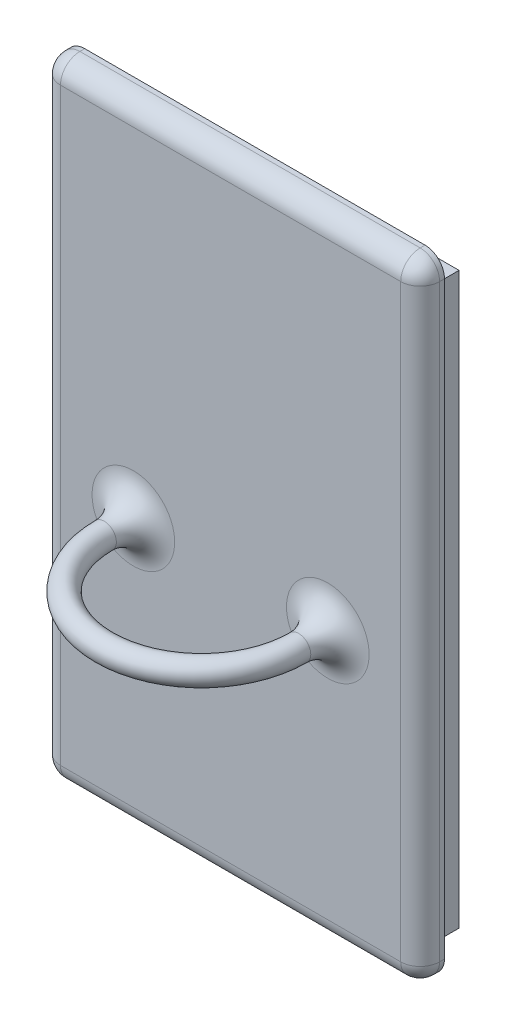
from build123d import *

# Parameters (mm, degrees)
BOSS_EXTRUDE1_DEPTH = 3.175
SWEEP1_PROFILE_R    = 1.5875
FILLET1_R           = 3.81
SKETCH14_W          = 49.53
SKETCH14_H          = 3.81
BOSS_EXTRUDE4_DEPTH = 3.175
FILLET2_R           = 2.54
FILLET4_R           = 2.54
SKETCH15_W          = 46.99
SKETCH15_H          = 74.422
SKETCH15_W_2        = 40.64
SKETCH15_H_2        = 68.072
BOSS_EXTRUDE6_DEPTH = 3.175


# Some blends are built 0.0001 mm under size
with BuildPart() as part:
    # Sketch1 → Boss-Extrude1 (new body)
    with BuildSketch(Plane.XY):
        Polygon((-24.765, -37.211), (24.765, -37.211), (24.765, -18.570359608), (24.765, 0.678999912), (24.765, 37.211), (-24.765, 37.211), (-24.765, 0.678999912), (-24.765, -18.570359608), align=None)
    extrude(amount=BOSS_EXTRUDE1_DEPTH)

    # Sweep1: sweep along a path in Sketch7
    with BuildLine(Plane(origin=(0, -5.770679848, 0), x_dir=(1, 0, 0), z_dir=(0, 1, 0))) as sweep1_path:
        Line((-12.7, -3.175), (-12.7, -6.985))
        ThreePointArc((-12.7, -6.985), (0, -19.685), (12.7, -6.985))
        Line((12.7, -6.985), (12.7, -3.175))
    # Sweep1 profile (on start of the path) → Sweep1 (sweep)
    with BuildSketch(Plane(origin=(-12.7, -5.770679848, 3.175), x_dir=(1, 0, 0), z_dir=(0, 0, 1))):
        Circle(SWEEP1_PROFILE_R)
    sweep(path=sweep1_path.line)

    # Fillet1
    fillet1_edges = [part.edges().sort_by_distance(p)[0] for p in [
        (14.2875, -5.770679848, 3.175),
        (-14.2875, -5.770679848, 3.175),
    ]]
    fillet(fillet1_edges, radius=FILLET1_R - 0.0001)  # a hair under: the kernel refuses the full size

    # Sketch14 → Boss-Extrude4 (add)
    with BuildSketch(Plane.XY.offset(3.175)):
        with Locations((0, -39.116)):
            Rectangle(SKETCH14_W, SKETCH14_H)
        with Locations((0, 39.116)):
            Rectangle(SKETCH14_W, SKETCH14_H)
    extrude(amount=-BOSS_EXTRUDE4_DEPTH)

    # Fillet2
    fillet2_edges = [part.edges().sort_by_distance(p)[0] for p in [
        (-24.765, 0, 3.175),
        (0, -41.021, 3.175),
        (24.765, 0, 3.175),
        (0, 41.021, 3.175),
    ]]
    fillet(fillet2_edges, radius=FILLET2_R)

    # Fillet4
    # the kernel refuses this fillet: 2.54 mm, written as the material it takes off along each edge
    with BuildSketch(Plane(origin=(-22.225, -38.481, 0.635), x_dir=(0, -1, 0), z_dir=(-1, 0, 0))) as fillet4_piece_1_section:
        Polygon((0, 0), (FILLET4_R, 0), (FILLET4_R, FILLET4_R), (0, FILLET4_R), align=None)
    fillet4_piece_1 = extrude(amount=FILLET4_R, mode=Mode.PRIVATE)
    fillet4_piece_1 = fillet4_piece_1 - Plane(origin=(-22.225, -38.481, 0.635), x_dir=(0, 0.7071067811865475, -0.7071067811865475), z_dir=(-1, 0, 0)) * Sphere(FILLET4_R, mode=Mode.PRIVATE)
    add(fillet4_piece_1, mode=Mode.SUBTRACT)
    with BuildSketch(Plane(origin=(-22.225, 38.481, 0.635), x_dir=(0, 1, 0), z_dir=(-1, 0, 0))) as fillet4_piece_2_section:
        Polygon((0, 0), (FILLET4_R, 0), (FILLET4_R, -FILLET4_R), (0, -FILLET4_R), align=None)
    fillet4_piece_2 = extrude(amount=FILLET4_R, mode=Mode.PRIVATE)
    fillet4_piece_2 = fillet4_piece_2 - Plane(origin=(-22.225, 38.481, 0.635), x_dir=(0, -0.7071067811865475, -0.7071067811865475), z_dir=(-1, 0, 0)) * Sphere(FILLET4_R, mode=Mode.PRIVATE)
    add(fillet4_piece_2, mode=Mode.SUBTRACT)
    with BuildSketch(Plane(origin=(22.225, -38.481, 0.635), x_dir=(1, 0, 0), z_dir=(0, -1, 0))) as fillet4_piece_3_section:
        Polygon((0, 0), (FILLET4_R, 0), (FILLET4_R, FILLET4_R), (0, FILLET4_R), align=None)
    fillet4_piece_3 = extrude(amount=FILLET4_R, mode=Mode.PRIVATE)
    fillet4_piece_3 = fillet4_piece_3 - Plane(origin=(22.225, -38.481, 0.635), x_dir=(-0.7071067811865475, 1.0781380386361295e-15, -0.7071067811865475), z_dir=(0, -1, 0)) * Sphere(FILLET4_R, mode=Mode.PRIVATE)
    add(fillet4_piece_3, mode=Mode.SUBTRACT)
    with BuildSketch(Plane(origin=(22.225, 38.481, 0.635), x_dir=(1, 0, 0), z_dir=(0, 1, 0))) as fillet4_piece_4_section:
        Polygon((0, 0), (FILLET4_R, 0), (FILLET4_R, -FILLET4_R), (0, -FILLET4_R), align=None)
    fillet4_piece_4 = extrude(amount=FILLET4_R, mode=Mode.PRIVATE)
    fillet4_piece_4 = fillet4_piece_4 - Plane(origin=(22.225, 38.481, 0.635), x_dir=(-0.7071067811865475, 1.0781380386361295e-15, -0.7071067811865475), z_dir=(0, 1, 0)) * Sphere(FILLET4_R, mode=Mode.PRIVATE)
    add(fillet4_piece_4, mode=Mode.SUBTRACT)
    with BuildSketch(Plane(origin=(24.765, -41.021, 0.635), x_dir=(-1, 0, 0), z_dir=(0, 0, -1)), Plane(origin=(-24.765, -41.021, 0.635), x_dir=(0, 1, 0), z_dir=(0, 0, -1))) as fillet4_piece_5:
        with BuildLine():
            CenterArc((FILLET4_R, FILLET4_R), FILLET4_R, 180, 90)
            Line((0, FILLET4_R), (0, 0))
            Line((0, 0), (FILLET4_R, 0))
        make_face()
    extrude(amount=6.985, mode=Mode.SUBTRACT)
    with BuildSketch(Plane(origin=(24.765, 41.021, 0.635), x_dir=(-1, 0, 0), z_dir=(0, 0, -1)), Plane(origin=(-24.765, 41.021, 0.635), x_dir=(0, -1, 0), z_dir=(0, 0, -1))) as fillet4_piece_6:
        with BuildLine():
            CenterArc((FILLET4_R, -FILLET4_R), FILLET4_R, 90, 90)
            Line((0, -FILLET4_R), (0, 0))
            Line((0, 0), (FILLET4_R, 0))
        make_face()
    extrude(amount=6.985, mode=Mode.SUBTRACT)

    # Sketch15 → Boss-Extrude6 (add)
    with BuildSketch(Plane(origin=(0, 0, 0), x_dir=(-1, 0, 0), z_dir=(0, 0, -1))):
        Rectangle(SKETCH15_W, SKETCH15_H)
        Rectangle(SKETCH15_W_2, SKETCH15_H_2, mode=Mode.SUBTRACT)
    extrude(amount=BOSS_EXTRUDE6_DEPTH)


solid = part.part
